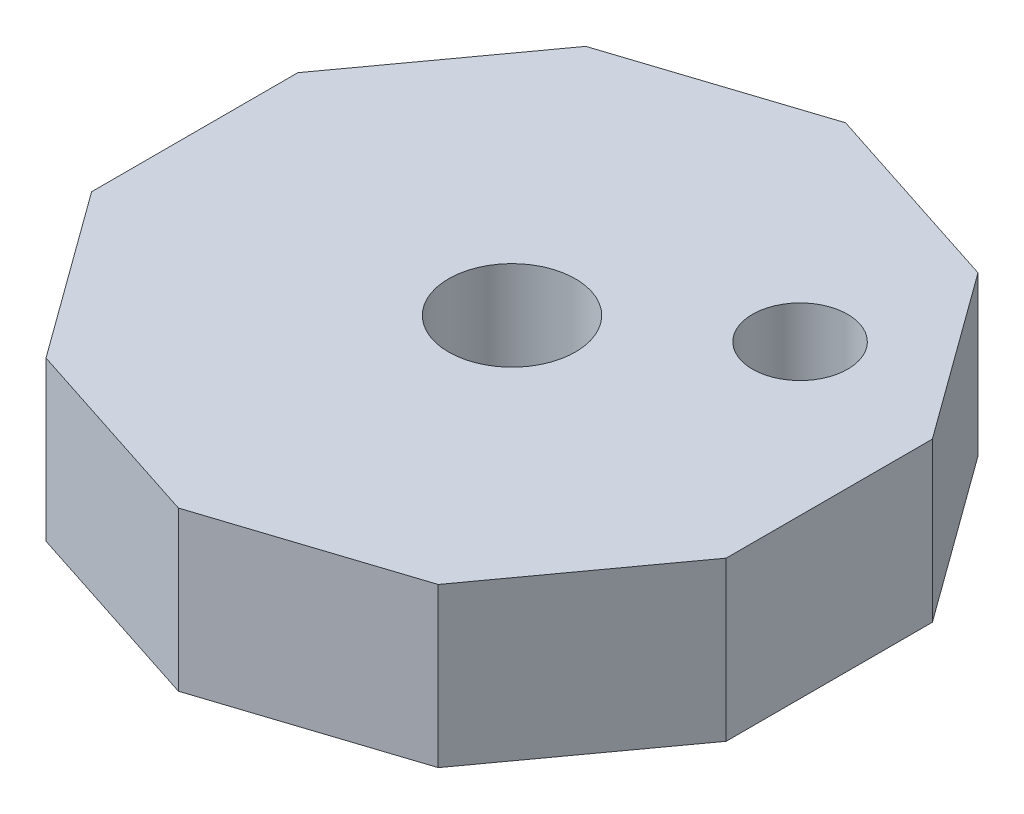
from build123d import *

# Parameters (mm, degrees)
BOSS_EXTRUDE1_DEPTH = 5
SKETCH2_R           = 1.5
SKETCH2_R_2         = 2
CUT_EXTRUDE1_DEPTH  = 5


with BuildPart() as part:
    # Sketch1 → Boss-Extrude1 (new body)
    with BuildSketch(Plane(origin=(0, 0, 0), x_dir=(1, 0, 0), z_dir=(0, 1, 0))):
        Polygon((6.180339887, -8.506508084), (10, -3.249196962), (10, 3.249196962), (6.180339887, 8.506508084), (0, 10.514622242), (-6.180339887, 8.506508084), (-10, 3.249196962), (-10, -3.249196962), (-6.180339887, -8.506508084), (0, -10.514622242), align=None)
    extrude(amount=BOSS_EXTRUDE1_DEPTH)

    # Sketch2 → Cut-Extrude1 (cut)
    with BuildSketch(Plane(origin=(0, 5, 0), x_dir=(1, 0, 0), z_dir=(0, 1, 0))):
        with Locations((5.258610463, 3.82060414)):
            Circle(SKETCH2_R)
        Circle(SKETCH2_R_2)
    extrude(amount=-CUT_EXTRUDE1_DEPTH, mode=Mode.SUBTRACT)


solid = part.part
